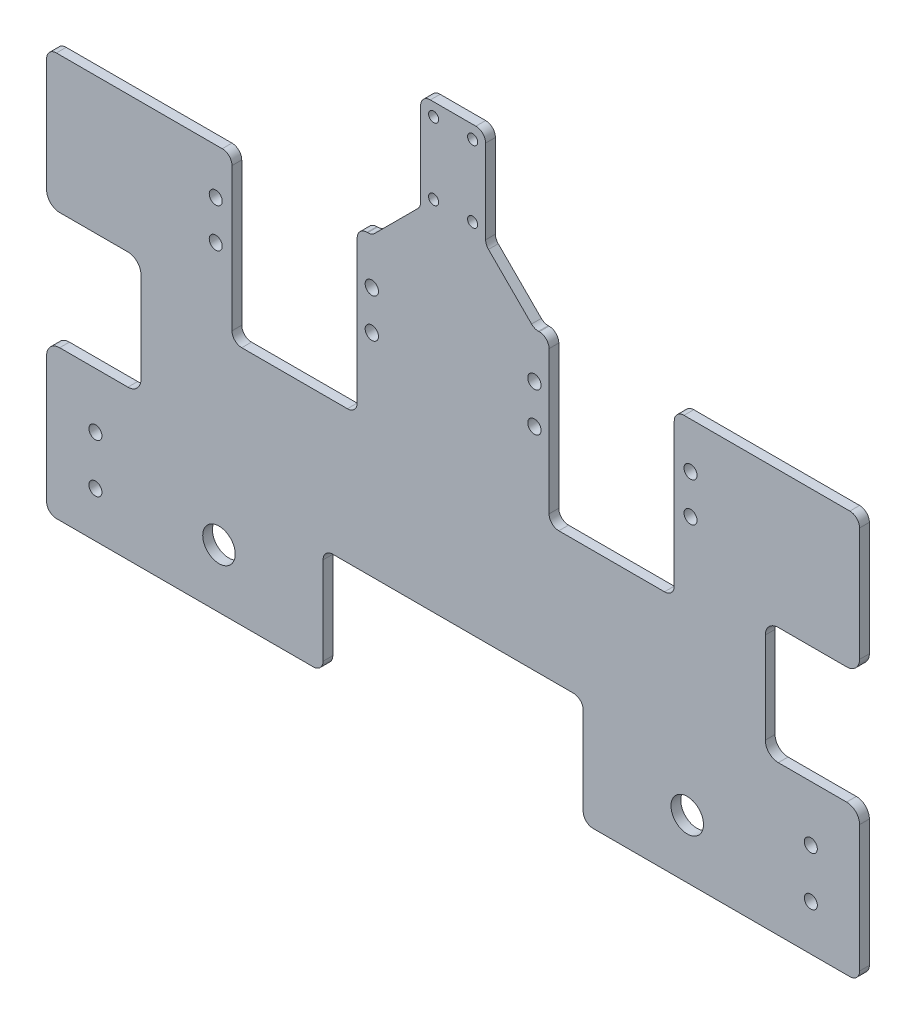
from build123d import *

# Parameters (mm, degrees)
EXTRUDE_1_DEPTH     = 3
SKETCH_2_R          = 1.55
CUT_EXTRUDE_1_DEPTH = 92.050809991
SKETCH_3_R          = 2.05
CUT_EXTRUDE_2_DEPTH = 92.050809991
SKETCH_4_W          = 3
SKETCH_4_H          = 40.476527492
CUT_EXTRUDE_3_DEPTH = 10
EXTRUDE_2_DEPTH     = 3
SKETCH_6_W          = 80
SKETCH_6_H          = 33
CUT_EXTRUDE_4_DEPTH = 4
FILLET_1_R          = 3
SKETCH_7_R          = 5
SKETCH_7_W          = 31
SKETCH_7_H          = 36
CUT_EXTRUDE_5_DEPTH = 4
SKETCH_8_R          = 2
CUT_EXTRUDE_6_DEPTH = 4
SKETCH_9_R          = 2
CUT_EXTRUDE_7_DEPTH = 4
FILLET_2_R          = 4


with BuildPart() as part:
    # 草图1 → 凸台-拉伸1 (new body)
    with BuildSketch(Plane.XY):
        Polygon((-32.5, 40), (-25, 40), (-10, 55), (-10, 85), (10, 85), (10, 55), (25, 40), (32.5, 40), (32.5, 0), (-32.5, 0), align=None)
    extrude(amount=EXTRUDE_1_DEPTH)

    # 草图2 → 切除-拉伸1 (cut, through all)
    with BuildSketch(Plane.XY.offset(3)):
        with Locations((-6, 81)):
            Circle(SKETCH_2_R)
        with Locations((-6, 59)):
            Circle(SKETCH_2_R)
        with Locations((6, 59)):
            Circle(SKETCH_2_R)
        with Locations((6, 81)):
            Circle(SKETCH_2_R)
    extrude(amount=-CUT_EXTRUDE_1_DEPTH, mode=Mode.SUBTRACT)

    # 草图3 → 切除-拉伸2 (cut, through all)
    with BuildSketch(Plane.XY.offset(3)):
        with Locations((-25, 26)):
            Circle(SKETCH_3_R)
        with Locations((-25, 14)):
            Circle(SKETCH_3_R)
        with Locations((25, 14)):
            Circle(SKETCH_3_R)
        with Locations((25, 26)):
            Circle(SKETCH_3_R)
    extrude(amount=-CUT_EXTRUDE_2_DEPTH, mode=Mode.SUBTRACT)

    # 草图4 → 切除-拉伸3 (cut)
    with BuildSketch(Plane.XY.offset(3)):
        with Locations((31, 19.761736254)):
            Rectangle(SKETCH_4_W, SKETCH_4_H)
        with Locations((-31, 19.761736254)):
            Rectangle(SKETCH_4_W, SKETCH_4_H)
    extrude(amount=-CUT_EXTRUDE_3_DEPTH, mode=Mode.SUBTRACT)

    # 草图5 → 凸台-拉伸2 (add)
    with BuildSketch(Plane.XY.offset(3)):
        Polygon((-125, 40), (-125, -84), (125, -84), (125, 40), (68, 40), (68, -10), (29.5, -10), (29.5, 0), (-29.5, 0), (-29.5, -10), (-68, -10), (-68, 40), align=None)
    extrude(amount=-EXTRUDE_2_DEPTH)

    # 草图6 → 切除-拉伸4 (cut)
    with BuildSketch(Plane.XY.offset(3)):
        with Locations((0, -67.5)):
            Rectangle(SKETCH_6_W, SKETCH_6_H)
    extrude(amount=-CUT_EXTRUDE_4_DEPTH, mode=Mode.SUBTRACT)

    # 圆角1
    fillet_1_edges = [part.edges().sort_by_distance(p)[0] for p in [
        (-40, -51, 1.5),
        (40, -51, 1.5),
        (40, -84, 1.5),
        (125, -84, 1.5),
        (68, 40, 1.5),
        (68, -10, 1.5),
        (29.5, -10, 1.5),
        (29.5, 40, 1.5),
        (25, 40, 1.5),
        (10, 55, 1.5),
        (10, 85, 1.5),
        (-10, 85, 1.5),
        (-10, 55, 1.5),
        (-25, 40, 1.5),
        (-29.5, 40, 1.5),
        (-29.5, -10, 1.5),
        (-68, -10, 1.5),
        (-68, 40, 1.5),
        (-125, 40, 1.5),
        (-125, -84, 1.5),
        (-40, -84, 1.5),
        (125, 40, 1.5),
    ]]
    fillet(fillet_1_edges, radius=FILLET_1_R)

    # 草图7 → 切除-拉伸5 (cut)
    with BuildSketch(Plane.XY.offset(3)):
        with Locations((72, -66)):
            Circle(SKETCH_7_R)
        with Locations((-72, -66)):
            Circle(SKETCH_7_R)
        with Locations((111.5, -20)):
            Rectangle(SKETCH_7_W, SKETCH_7_H)
        with Locations((-111.5, -20)):
            Rectangle(SKETCH_7_W, SKETCH_7_H)
    extrude(amount=-CUT_EXTRUDE_5_DEPTH, mode=Mode.SUBTRACT)

    # 草图8 → 切除-拉伸6 (cut)
    with BuildSketch(Plane.XY.offset(3)):
        with Locations((73, 26)):
            Circle(SKETCH_8_R)
        with Locations((73, 14)):
            Circle(SKETCH_8_R)
        with Locations((-73, 14)):
            Circle(SKETCH_8_R)
        with Locations((-73, 26)):
            Circle(SKETCH_8_R)
    extrude(amount=-CUT_EXTRUDE_6_DEPTH, mode=Mode.SUBTRACT)

    # 草图9 → 切除-拉伸7 (cut)
    with BuildSketch(Plane.XY.offset(3)):
        with Locations((110, -55)):
            Circle(SKETCH_9_R)
        with Locations((110, -70)):
            Circle(SKETCH_9_R)
        with Locations((-110, -70)):
            Circle(SKETCH_9_R)
        with Locations((-110, -55)):
            Circle(SKETCH_9_R)
    extrude(amount=-CUT_EXTRUDE_7_DEPTH, mode=Mode.SUBTRACT)

    # 圆角2
    fillet_2_edges = [part.edges().sort_by_distance(p)[0] for p in [
        (-96, -38, 1.5),
        (-125, -38, 1.5),
        (125, -38, 1.5),
        (96, -38, 1.5),
        (125, -2, 1.5),
        (-125, -2, 1.5),
        (-96, -2, 1.5),
        (96, -2, 1.5),
    ]]
    fillet(fillet_2_edges, radius=FILLET_2_R)


solid = part.part
